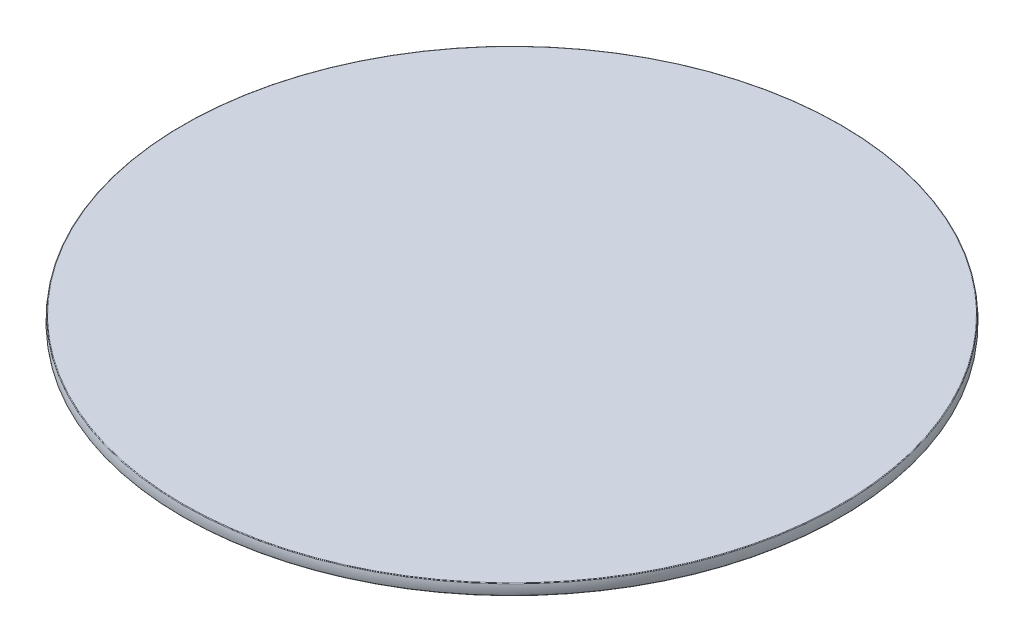
from build123d import *
from build123d.topology import SkipClean

# Parameters (mm, degrees)
SKETCH1_R           = 150
BOSS_EXTRUDE1_DEPTH = 5
FILLET1_R           = 0.3


with BuildPart() as part:
    # Sketch1 → Boss-Extrude1 (new body)
    with BuildSketch(Plane(origin=(0, 0, 0), x_dir=(1, 0, 0), z_dir=(0, 1, 0))):
        Circle(SKETCH1_R)
    extrude(amount=BOSS_EXTRUDE1_DEPTH)

    # Sketch2 → Cut-Revolve2 (revolve, cut)
    with SkipClean():  # the faces are left unmerged after this step: merging them gives an invalid solid
        with BuildSketch(Plane.XY):
            with BuildLine():
                Line((-150, 5), (-152.218260016, 5))
                Line((-152.218260016, 5), (-152.218260016, 0))
                Line((-152.218260016, 0), (-150, 0))
                Line((-150, 0), (-149.736694594, 0))
                ThreePointArc((-149.736694594, 0), (-150, 2.5), (-149.736694594, 5))
                Line((-149.736694594, 5), (-150, 5))
            make_face()
        revolve(axis=Axis((0, 0, 0), (0, 1, 0)), mode=Mode.SUBTRACT)
    add(part.part.scale(1), mode=Mode.REPLACE)  # the faces are merged on a copy

    # Fillet1
    fillet1_edges = [part.edges().sort_by_distance(p)[0] for p in [
        (149.736694594, 0, 0),
        (149.736694594, 5, 0),
    ]]
    fillet(fillet1_edges, radius=FILLET1_R)


solid = part.part
